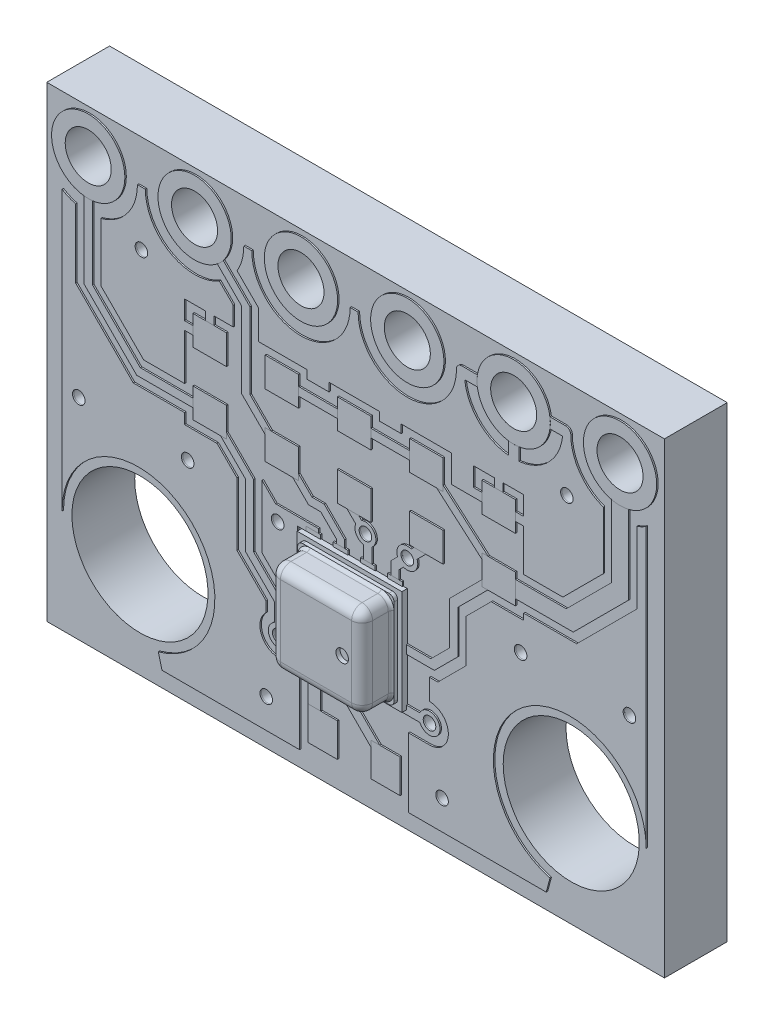
from build123d import *

# Parameters (mm, degrees)
SKETCH_1_W               = 2.5
SKETCH_1_H               = 0.13
EXTRUDE_1_DEPTH          = 1.25
EXTRUDE_2_DEPTH          = 1.25
PATTERN_CIRCULAR_1_COUNT = 2
PATTERN_CIRCULAR_1_ANGLE = 90
SKETCH_2_W               = 0.4
SKETCH_2_H               = 0.4
CUT_EXTRUDE_1_DEPTH      = 2.940360791
CUT_EXTRUDE_2_DEPTH      = 3.614842251
CUT_EXTRUDE_3_DEPTH      = 3.614842251
REVOLVE_1_ANGLE          = 90
REVOLVE_2_ANGLE          = 90
REVOLVE_3_ANGLE          = 90
REVOLVE_4_ANGLE          = 90
EXTRUDE_3_DEPTH          = 0.0884
SKETCH_10_R              = 0.15
CUT_EXTRUDE_4_DEPTH      = 0.8
SKETCH_11_R              = 0.1
EXTRUDE_4_DEPTH          = 0.015
SKETCH_11_W              = 0.35
SKETCH_11_H              = 0.35
EXTRUDE_4_2_DEPTH        = 0.015
EXTRUDE_4_3_DEPTH        = 0.015
EXTRUDE_4_4_DEPTH        = 0.015
EXTRUDE_4_5_DEPTH        = 0.015
EXTRUDE_4_6_DEPTH        = 0.015
EXTRUDE_4_7_DEPTH        = 0.015
EXTRUDE_4_8_DEPTH        = 0.015
EXTRUDE_4_9_DEPTH        = 0.015
SKETCH_14_W              = 14.75
SKETCH_14_H              = 11.15
SKETCH_14_R              = 1.625
SKETCH_14_R_2            = 0.575
SKETCH_14_R_3            = 0.15
PCB_DEPTH                = 1.5
SKETCH_15_R              = 0.575
SKETCH_15_R_2            = 0.55
EXTRUDE_6_DEPTH          = 1.5
EXTRUDE_6_2_DEPTH        = 1.5
EXTRUDE_6_3_DEPTH        = 1.5
EXTRUDE_6_4_DEPTH        = 1.5
EXTRUDE_6_5_DEPTH        = 1.5
EXTRUDE_6_6_DEPTH        = 1.5
SKETCH_16_R              = 0.875
SKETCH_16_R_2            = 0.55
EXTRUDE_7_DEPTH          = 0.035
SKETCH_17_R              = 0.875
SKETCH_17_R_2            = 0.55
EXTRUDE_8_DEPTH          = 0.035
SKETCH_18_W              = 0.8
SKETCH_18_H              = 0.7
EXTRUDE_9_DEPTH          = 0.035
EXTRUDE_9_2_DEPTH        = 0.035
EXTRUDE_9_3_DEPTH        = 0.035
EXTRUDE_9_4_DEPTH        = 0.035
EXTRUDE_9_5_DEPTH        = 0.035
EXTRUDE_9_6_DEPTH        = 0.035
EXTRUDE_9_7_DEPTH        = 0.035
EXTRUDE_9_8_DEPTH        = 0.035
EXTRUDE_9_9_DEPTH        = 0.035
EXTRUDE_9_10_DEPTH       = 0.035
SKETCH_18_W_2            = 0.7
SKETCH_18_H_2            = 0.8
EXTRUDE_9_11_DEPTH       = 0.035
EXTRUDE_9_12_DEPTH       = 0.035
SKETCH_19_R              = 0.15
EXTRUDE_11_DEPTH         = 0.035
EXTRUDE_11_2_DEPTH       = 0.035
EXTRUDE_11_3_DEPTH       = 0.035
EXTRUDE_11_4_DEPTH       = 0.035
SKETCH_20_W              = 0.35
SKETCH_20_H              = 0.5
EXTRUDE_12_DEPTH         = 0.035
EXTRUDE_12_2_DEPTH       = 0.035
EXTRUDE_12_3_DEPTH       = 0.035
EXTRUDE_12_4_DEPTH       = 0.035
EXTRUDE_12_5_DEPTH       = 0.035
EXTRUDE_12_6_DEPTH       = 0.035
EXTRUDE_12_7_DEPTH       = 0.035
EXTRUDE_12_8_DEPTH       = 0.035
SKETCH_21_R              = 0.15
EXTRUDE_13_DEPTH         = 0.035
EXTRUDE_13_2_DEPTH       = 0.035
EXTRUDE_13_3_DEPTH       = 0.035
EXTRUDE_13_4_DEPTH       = 0.035
EXTRUDE_13_5_DEPTH       = 0.035
EXTRUDE_13_6_DEPTH       = 0.035
EXTRUDE_13_7_DEPTH       = 0.035
EXTRUDE_13_8_DEPTH       = 0.035
EXTRUDE_13_9_DEPTH       = 0.035
EXTRUDE_13_10_DEPTH      = 0.035
EXTRUDE_13_11_DEPTH      = 0.035
EXTRUDE_13_12_DEPTH      = 0.035
SKETCH_21_W              = 0.925
SKETCH_21_H              = 0.2
EXTRUDE_13_13_DEPTH      = 0.035
EXTRUDE_13_14_DEPTH      = 0.035
EXTRUDE_13_15_DEPTH      = 0.035
EXTRUDE_13_16_DEPTH      = 0.035
EXTRUDE_13_17_DEPTH      = 0.035
SKETCH_21_W_2            = 0.3
SKETCH_21_H_2            = 0.95
EXTRUDE_13_18_DEPTH      = 0.035
EXTRUDE_13_19_DEPTH      = 0.035


with BuildPart() as part:
    # Эскиз1 → Бобышка-Вытянуть1 (new, symmetric)
    with BuildSketch(Plane(origin=(0, 0, 0), x_dir=(1, 0, 0), z_dir=(0, 1, 0))):
        with Locations((0, -0.065)):
            Rectangle(SKETCH_1_W, SKETCH_1_H)
    extrude(amount=EXTRUDE_1_DEPTH, both=True)


with BuildPart() as body_2:
    # Эскиз1<3> → Бобышка-Вытянуть2 (new, symmetric)
    with BuildSketch(Plane(origin=(0, 0, 0), x_dir=(1, 0, 0), z_dir=(0, 1, 0))):
        with BuildLine():
            Line((-1.103175416, -0.13), (-1.15, -0.13))
            Line((-1.15, -0.13), (-1.15, -0.21839746))
            ThreePointArc((-1.15, -0.21839746), (-1.11339746, -0.255), (-1.1, -0.305))
            Line((-1.1, -0.305), (-1.1, -0.68))
            ThreePointArc((-1.1, -0.68), (-1.026776695, -0.856776695), (-0.85, -0.93))
            Line((-0.85, -0.93), (0, -0.93))
            Line((0, -0.93), (0, -0.83))
            Line((0, -0.83), (-0.85, -0.83))
            ThreePointArc((-0.85, -0.83), (-0.956066017, -0.786066017), (-1, -0.68))
            Line((-1, -0.68), (-1, -0.305))
            ThreePointArc((-1, -0.305), (-1.027714022, -0.2034247), (-1.103175416, -0.13))
        make_face()
        with BuildLine():
            Line((1.15, -0.21839746), (1.15, -0.13))
            Line((1.15, -0.13), (1.103175416, -0.13))
            ThreePointArc((1.103175416, -0.13), (1.027714022, -0.2034247), (1, -0.305))
            Line((1, -0.305), (1, -0.68))
            ThreePointArc((1, -0.68), (0.956066017, -0.786066017), (0.85, -0.83))
            Line((0.85, -0.83), (0, -0.83))
            Line((0, -0.83), (0, -0.93))
            Line((0, -0.93), (0.85, -0.93))
            ThreePointArc((0.85, -0.93), (1.026776695, -0.856776695), (1.1, -0.68))
            Line((1.1, -0.68), (1.1, -0.305))
            ThreePointArc((1.1, -0.305), (1.11339746, -0.255), (1.15, -0.21839746))
        make_face()
    extrude(amount=EXTRUDE_2_DEPTH, both=True)


with BuildPart() as pattern_circular_1_1:
    # Круговой массив1: pattern copy
    add(body_2.part.rotate(Axis((0, 0, 0), (0, 0, 1)), 1 * PATTERN_CIRCULAR_1_ANGLE / (PATTERN_CIRCULAR_1_COUNT - 1)))


with BuildPart() as cut_extrude_1_tool:
    # Эскиз2 → Вырез-Вытянуть1 (new, through all)
    with BuildSketch(Plane.XY.offset(0.13)):
        with Locations((-1.05, 1.05)):
            Rectangle(SKETCH_2_W, SKETCH_2_H)
        with Locations((1.05, 1.05)):
            Rectangle(SKETCH_2_W, SKETCH_2_H)
        with Locations((-1.05, -1.05)):
            Rectangle(SKETCH_2_W, SKETCH_2_H)
        with Locations((1.05, -1.05)):
            Rectangle(SKETCH_2_W, SKETCH_2_H)
    extrude(amount=CUT_EXTRUDE_1_DEPTH)


with BuildPart() as body_2_1:
    add(body_2.part)

    # Вырез-Вытянуть1: cut by cut_extrude_1_tool
    add(cut_extrude_1_tool.part, mode=Mode.SUBTRACT)

    # Эскиз4 → Вырез-Вытянуть3 (cut, through all)
    with BuildSketch(Plane(origin=(0.85, 0, 0), x_dir=(0, 0, -1), z_dir=(1, 0, 0))):
        with BuildLine():
            ThreePointArc((-0.83, -1.05), (-0.903606798, -0.961803399), (-0.93, -0.85))
            Line((-0.93, -0.85), (-0.93, -1.25))
            Line((-0.93, -1.25), (-0.83, -1.25))
            Line((-0.83, -1.25), (-0.83, -1.05))
        make_face()
        with BuildLine():
            Line((-0.93, 1.25), (-0.93, 0.85))
            ThreePointArc((-0.93, 0.85), (-0.903606798, 0.961803399), (-0.83, 1.05))
            Line((-0.83, 1.05), (-0.83, 1.25))
            Line((-0.83, 1.25), (-0.93, 1.25))
        make_face()
    extrude(amount=-CUT_EXTRUDE_3_DEPTH, mode=Mode.SUBTRACT)



with BuildPart() as pattern_circular_1_1_1:
    add(pattern_circular_1_1.part)

    # Вырез-Вытянуть1: cut by cut_extrude_1_tool
    add(cut_extrude_1_tool.part, mode=Mode.SUBTRACT)

    # Эскиз3 → Вырез-Вытянуть2 (cut, through all)
    with BuildSketch(Plane.XZ.offset(0.85)):
        with BuildLine():
            ThreePointArc((-1.05, 0.83), (-0.961803399, 0.903606798), (-0.85, 0.93))
            Line((-0.85, 0.93), (-1.25, 0.93))
            Line((-1.25, 0.93), (-1.25, 0.83))
            Line((-1.25, 0.83), (-1.05, 0.83))
        make_face()
        with BuildLine():
            Line((1.25, 0.93), (0.85, 0.93))
            ThreePointArc((0.85, 0.93), (0.961803399, 0.903606798), (1.05, 0.83))
            Line((1.05, 0.83), (1.25, 0.83))
            Line((1.25, 0.83), (1.25, 0.93))
        make_face()
    extrude(amount=-CUT_EXTRUDE_2_DEPTH, mode=Mode.SUBTRACT)


with BuildPart() as body_2_2:
    add(body_2_1.part)

    add(pattern_circular_1_1_1.part)  # Повернуть1 merges Круговой массив1_1
    # Эскиз5 → Повернуть1 (revolve)
    with BuildSketch(Plane(origin=(0.85, 0, 0), x_dir=(0, 0, -1), z_dir=(1, 0, 0))):
        with BuildLine():
            Line((-0.68, 1), (-0.305, 1))
            ThreePointArc((-0.305, 1), (-0.2034247, 1.027714022), (-0.13, 1.103175416))
            Line((-0.13, 1.103175416), (-0.13, 1.15))
            Line((-0.13, 1.15), (-0.21839746, 1.15))
            ThreePointArc((-0.21839746, 1.15), (-0.255, 1.11339746), (-0.305, 1.1))
            Line((-0.305, 1.1), (-0.68, 1.1))
            ThreePointArc((-0.68, 1.1), (-0.856776695, 1.026776695), (-0.93, 0.85))
            Line((-0.93, 0.85), (-0.83, 0.85))
            ThreePointArc((-0.83, 0.85), (-0.786066017, 0.956066017), (-0.68, 1))
        make_face()
    revolve(axis=Axis((0.85, 0.85, 0.93), (0, 0, -1)), revolution_arc=REVOLVE_1_ANGLE)

    # Эскиз6 → Повернуть2 (revolve)
    with BuildSketch(Plane.XZ.offset(0.85)):
        with BuildLine():
            Line((0.85, 0.93), (0.85, 0.83))
            ThreePointArc((0.85, 0.83), (0.956066017, 0.786066017), (1, 0.68))
            Line((1, 0.68), (1, 0.305))
            ThreePointArc((1, 0.305), (1.027714022, 0.2034247), (1.103175416, 0.13))
            Line((1.103175416, 0.13), (1.15, 0.13))
            Line((1.15, 0.13), (1.15, 0.21839746))
            ThreePointArc((1.15, 0.21839746), (1.11339746, 0.255), (1.1, 0.305))
            Line((1.1, 0.305), (1.1, 0.68))
            ThreePointArc((1.1, 0.68), (1.026776695, 0.856776695), (0.85, 0.93))
        make_face()
    revolve(axis=Axis((0.85, -0.85, 0.93), (0, 0, -1)), revolution_arc=REVOLVE_2_ANGLE)

    # Эскиз7 → Повернуть3 (revolve)
    with BuildSketch(Plane.ZY.offset(0.85)):
        with BuildLine():
            Line((0.93, -0.85), (0.83, -0.85))
            ThreePointArc((0.83, -0.85), (0.786066017, -0.956066017), (0.68, -1))
            Line((0.68, -1), (0.305, -1))
            ThreePointArc((0.305, -1), (0.2034247, -1.027714022), (0.13, -1.103175416))
            Line((0.13, -1.103175416), (0.13, -1.15))
            Line((0.13, -1.15), (0.21839746, -1.15))
            ThreePointArc((0.21839746, -1.15), (0.255, -1.11339746), (0.305, -1.1))
            Line((0.305, -1.1), (0.68, -1.1))
            ThreePointArc((0.68, -1.1), (0.856776695, -1.026776695), (0.93, -0.85))
        make_face()
    revolve(axis=Axis((-0.85, -0.85, 0.93), (0, 0, -1)), revolution_arc=REVOLVE_3_ANGLE)

    # Эскиз8 → Повернуть4 (revolve)
    with BuildSketch(Plane(origin=(0, 0.85, 0), x_dir=(1, 0, 0), z_dir=(0, 1, 0))):
        with BuildLine():
            Line((-0.85, -0.93), (-0.85, -0.83))
            ThreePointArc((-0.85, -0.83), (-0.956066017, -0.786066017), (-1, -0.68))
            Line((-1, -0.68), (-1, -0.305))
            ThreePointArc((-1, -0.305), (-1.027714022, -0.2034247), (-1.103175416, -0.13))
            Line((-1.103175416, -0.13), (-1.15, -0.13))
            Line((-1.15, -0.13), (-1.15, -0.21839746))
            ThreePointArc((-1.15, -0.21839746), (-1.11339746, -0.255), (-1.1, -0.305))
            Line((-1.1, -0.305), (-1.1, -0.68))
            ThreePointArc((-1.1, -0.68), (-1.026776695, -0.856776695), (-0.85, -0.93))
        make_face()
    revolve(axis=Axis((-0.85, 0.85, 0.93), (0, 0, -1)), revolution_arc=REVOLVE_4_ANGLE)

    # Эскиз9 → Бобышка-Вытянуть3 (add)
    with BuildSketch(Plane.XY.offset(0.13)):
        with BuildLine():
            Line((-0.85, 1.15), (-1.03, 1.15))
            ThreePointArc((-1.03, 1.15), (-1.114852814, 1.114852814), (-1.15, 1.03))
            Line((-1.15, 1.03), (-1.15, 0.85))
            ThreePointArc((-1.15, 0.85), (-1.062132034, 1.062132034), (-0.85, 1.15))
        make_face()
        with BuildLine():
            Line((1.03, 1.15), (0.85, 1.15))
            ThreePointArc((0.85, 1.15), (1.062132034, 1.062132034), (1.15, 0.85))
            Line((1.15, 0.85), (1.15, 1.03))
            ThreePointArc((1.15, 1.03), (1.114852814, 1.114852814), (1.03, 1.15))
        make_face()
        with BuildLine():
            ThreePointArc((-0.85, -1.15), (-1.062132034, -1.062132034), (-1.15, -0.85))
            Line((-1.15, -0.85), (-1.15, -1.03))
            ThreePointArc((-1.15, -1.03), (-1.114852814, -1.114852814), (-1.03, -1.15))
            Line((-1.03, -1.15), (-0.85, -1.15))
        make_face()
        with BuildLine():
            Line((1.15, -1.03), (1.15, -0.85))
            ThreePointArc((1.15, -0.85), (1.062132034, -1.062132034), (0.85, -1.15))
            Line((0.85, -1.15), (1.03, -1.15))
            ThreePointArc((1.03, -1.15), (1.114852814, -1.114852814), (1.15, -1.03))
        make_face()
    extrude(amount=EXTRUDE_3_DEPTH)

    # Эскиз10 → Вырез-Вытянуть4 (cut)
    with BuildSketch(Plane.XY.offset(0.93)):
        with Locations((0.625, 0.012)):
            Circle(SKETCH_10_R)
    extrude(amount=-CUT_EXTRUDE_4_DEPTH, mode=Mode.SUBTRACT)


with BuildPart() as body_3:
    # Эскиз11 → Бобышка-Вытянуть4 (new body)
    with BuildSketch(Plane(origin=(0, 0, 0), x_dir=(-1, 0, 0), z_dir=(0, 0, -1))):
        with Locations((0.975, 0.5)):
            Circle(SKETCH_11_R)
    extrude(amount=EXTRUDE_4_DEPTH)


with BuildPart() as body_4:
    # Эскиз11 → Extrude 4 2 (new body)
    with BuildSketch(Plane(origin=(0, 0, 0), x_dir=(-1, 0, 0), z_dir=(0, 0, -1))):
        with Locations((-0.975, 0.975)):
            Rectangle(SKETCH_11_W, SKETCH_11_H)
    extrude(amount=EXTRUDE_4_2_DEPTH)


with BuildPart() as body_5:
    # Эскиз11 → Extrude 4 3 (new body)
    with BuildSketch(Plane(origin=(0, 0, 0), x_dir=(-1, 0, 0), z_dir=(0, 0, -1))):
        with Locations((-0.325, 0.975)):
            Rectangle(SKETCH_11_W, SKETCH_11_H)
    extrude(amount=EXTRUDE_4_3_DEPTH)


with BuildPart() as body_6:
    # Эскиз11 → Extrude 4 4 (new body)
    with BuildSketch(Plane(origin=(0, 0, 0), x_dir=(-1, 0, 0), z_dir=(0, 0, -1))):
        with Locations((0.325, 0.975)):
            Rectangle(SKETCH_11_W, SKETCH_11_H)
    extrude(amount=EXTRUDE_4_4_DEPTH)


with BuildPart() as body_7:
    # Эскиз11 → Extrude 4 5 (new body)
    with BuildSketch(Plane(origin=(0, 0, 0), x_dir=(-1, 0, 0), z_dir=(0, 0, -1))):
        with Locations((0.975, 0.975)):
            Rectangle(SKETCH_11_W, SKETCH_11_H)
    extrude(amount=EXTRUDE_4_5_DEPTH)


with BuildPart() as body_8:
    # Эскиз11 → Extrude 4 6 (new body)
    with BuildSketch(Plane(origin=(0, 0, 0), x_dir=(-1, 0, 0), z_dir=(0, 0, -1))):
        with Locations((-0.975, -0.975)):
            Rectangle(SKETCH_11_W, SKETCH_11_H)
    extrude(amount=EXTRUDE_4_6_DEPTH)


with BuildPart() as body_9:
    # Эскиз11 → Extrude 4 7 (new body)
    with BuildSketch(Plane(origin=(0, 0, 0), x_dir=(-1, 0, 0), z_dir=(0, 0, -1))):
        with Locations((-0.325, -0.975)):
            Rectangle(SKETCH_11_W, SKETCH_11_H)
    extrude(amount=EXTRUDE_4_7_DEPTH)


with BuildPart() as body_10:
    # Эскиз11 → Extrude 4 8 (new body)
    with BuildSketch(Plane(origin=(0, 0, 0), x_dir=(-1, 0, 0), z_dir=(0, 0, -1))):
        with Locations((0.325, -0.975)):
            Rectangle(SKETCH_11_W, SKETCH_11_H)
    extrude(amount=EXTRUDE_4_8_DEPTH)


with BuildPart() as body_11:
    # Эскиз11 → Extrude 4 9 (new body)
    with BuildSketch(Plane(origin=(0, 0, 0), x_dir=(-1, 0, 0), z_dir=(0, 0, -1))):
        with Locations((0.975, -0.975)):
            Rectangle(SKETCH_11_W, SKETCH_11_H)
    extrude(amount=EXTRUDE_4_9_DEPTH)


with BuildPart() as body_12:
    # Эскиз14 → PCB (new body)
    with BuildSketch(Plane(origin=(0, 0, -0.015), x_dir=(-1, 0, 0), z_dir=(0, 0, -1))):
        with Locations((0, 1.825)):
            Rectangle(SKETCH_14_W, SKETCH_14_H)
        with Locations((-5.15, -1.25)):
            Circle(SKETCH_14_R, mode=Mode.SUBTRACT)
        with Locations((5.15, -1.25)):
            Circle(SKETCH_14_R, mode=Mode.SUBTRACT)
        with Locations((3.81, 6.4)):
            Circle(SKETCH_14_R_2, mode=Mode.SUBTRACT)
        with Locations((-6.35, 6.4)):
            Circle(SKETCH_14_R_2, mode=Mode.SUBTRACT)
        with Locations((-3.81, 6.4)):
            Circle(SKETCH_14_R_2, mode=Mode.SUBTRACT)
        with Locations((-1.27, 6.4)):
            Circle(SKETCH_14_R_2, mode=Mode.SUBTRACT)
        with Locations((1.27, 6.4)):
            Circle(SKETCH_14_R_2, mode=Mode.SUBTRACT)
        with Locations((6.35, 6.4)):
            Circle(SKETCH_14_R_2, mode=Mode.SUBTRACT)
        with Locations((1.825, 1.1)):
            Circle(SKETCH_14_R_3, mode=Mode.SUBTRACT)
        with Locations((-5.08, 5.1)):
            Circle(SKETCH_14_R_3, mode=Mode.SUBTRACT)
        with Locations((5.08, 5.1)):
            Circle(SKETCH_14_R_3, mode=Mode.SUBTRACT)
        with Locations((-6.575, 1.3)):
            Circle(SKETCH_14_R_3, mode=Mode.SUBTRACT)
        with Locations((-3.975, 1.3)):
            Circle(SKETCH_14_R_3, mode=Mode.SUBTRACT)
        with Locations((-1.27, 1.9)):
            Circle(SKETCH_14_R_3, mode=Mode.SUBTRACT)
        with Locations((-0.27, 1.9)):
            Circle(SKETCH_14_R_3, mode=Mode.SUBTRACT)
        with Locations((6.575, 1.3)):
            Circle(SKETCH_14_R_3, mode=Mode.SUBTRACT)
        with Locations((3.975, 1.3)):
            Circle(SKETCH_14_R_3, mode=Mode.SUBTRACT)
        with Locations((1.8, -1.25)):
            Circle(SKETCH_14_R_3, mode=Mode.SUBTRACT)
        with Locations((-1.8, -1.25)):
            Circle(SKETCH_14_R_3, mode=Mode.SUBTRACT)
        with Locations((-2.1, -2.65)):
            Circle(SKETCH_14_R_3, mode=Mode.SUBTRACT)
        with Locations((2.1, -2.65)):
            Circle(SKETCH_14_R_3, mode=Mode.SUBTRACT)
    extrude(amount=PCB_DEPTH)


with BuildPart() as body_13:
    # Эскиз15 → Бобышка-Вытянуть6 (new body)
    with BuildSketch(Plane(origin=(0, 0, -1.515), x_dir=(-1, 0, 0), z_dir=(0, 0, -1))):
        with Locations((-6.35, 6.4)):
            Circle(SKETCH_15_R)
        with Locations((-6.35, 6.4)):
            Circle(SKETCH_15_R_2, mode=Mode.SUBTRACT)
    extrude(amount=-EXTRUDE_6_DEPTH)



with BuildPart() as body_14:
    # Эскиз15 → Extrude 6 2 (new body)
    with BuildSketch(Plane(origin=(0, 0, -1.515), x_dir=(-1, 0, 0), z_dir=(0, 0, -1))):
        with Locations((-3.81, 6.4)):
            Circle(SKETCH_15_R)
        with Locations((-3.81, 6.4)):
            Circle(SKETCH_15_R_2, mode=Mode.SUBTRACT)
    extrude(amount=-EXTRUDE_6_2_DEPTH)


with BuildPart() as body_15:
    # Эскиз15 → Extrude 6 3 (new body)
    with BuildSketch(Plane(origin=(0, 0, -1.515), x_dir=(-1, 0, 0), z_dir=(0, 0, -1))):
        with Locations((-1.27, 6.4)):
            Circle(SKETCH_15_R)
        with Locations((-1.27, 6.4)):
            Circle(SKETCH_15_R_2, mode=Mode.SUBTRACT)
    extrude(amount=-EXTRUDE_6_3_DEPTH)


with BuildPart() as body_16:
    # Эскиз15 → Extrude 6 4 (new body)
    with BuildSketch(Plane(origin=(0, 0, -1.515), x_dir=(-1, 0, 0), z_dir=(0, 0, -1))):
        with Locations((1.27, 6.4)):
            Circle(SKETCH_15_R)
        with Locations((1.27, 6.4)):
            Circle(SKETCH_15_R_2, mode=Mode.SUBTRACT)
    extrude(amount=-EXTRUDE_6_4_DEPTH)


with BuildPart() as body_17:
    # Эскиз15 → Extrude 6 5 (new body)
    with BuildSketch(Plane(origin=(0, 0, -1.515), x_dir=(-1, 0, 0), z_dir=(0, 0, -1))):
        with Locations((3.81, 6.4)):
            Circle(SKETCH_15_R)
        with Locations((3.81, 6.4)):
            Circle(SKETCH_15_R_2, mode=Mode.SUBTRACT)
    extrude(amount=-EXTRUDE_6_5_DEPTH)


with BuildPart() as body_18:
    # Эскиз15 → Extrude 6 6 (new body)
    with BuildSketch(Plane(origin=(0, 0, -1.515), x_dir=(-1, 0, 0), z_dir=(0, 0, -1))):
        with Locations((6.35, 6.4)):
            Circle(SKETCH_15_R)
        with Locations((6.35, 6.4)):
            Circle(SKETCH_15_R_2, mode=Mode.SUBTRACT)
    extrude(amount=-EXTRUDE_6_6_DEPTH)


with BuildPart() as body_13_1:
    add(body_13.part)

    add(body_14.part)  # Бобышка-Вытянуть7 merges body 14

    add(body_15.part)  # Бобышка-Вытянуть7 merges body 15

    add(body_16.part)  # Бобышка-Вытянуть7 merges body 16

    add(body_17.part)  # Бобышка-Вытянуть7 merges body 17

    add(body_18.part)  # Бобышка-Вытянуть7 merges body 18
    # Эскиз16 → Бобышка-Вытянуть7 (add)
    # profile 1 of 6: a face of its own
    with BuildSketch(Plane.XY.offset(-0.015)):
        with Locations((6.35, 6.4)):
            Circle(SKETCH_16_R)
        with Locations(Location((6.35, 6.4, 0), (0, 0, 180))):
            Circle(SKETCH_16_R_2, mode=Mode.SUBTRACT)
    # profile 2 of 6: a face of its own
    with BuildSketch(Plane.XY.offset(-0.015)):
        with Locations((3.81, 6.4)):
            Circle(SKETCH_16_R)
        with Locations(Location((3.81, 6.4, 0), (0, 0, 180))):
            Circle(SKETCH_16_R_2, mode=Mode.SUBTRACT)
    # profile 3 of 6: a face of its own
    with BuildSketch(Plane.XY.offset(-0.015)):
        with Locations((1.27, 6.4)):
            Circle(SKETCH_16_R)
        with Locations(Location((1.27, 6.4, 0), (0, 0, 180))):
            Circle(SKETCH_16_R_2, mode=Mode.SUBTRACT)
    # profile 4 of 6: a face of its own
    with BuildSketch(Plane.XY.offset(-0.015)):
        with Locations((-1.27, 6.4)):
            Circle(SKETCH_16_R)
        with Locations(Location((-1.27, 6.4, 0), (0, 0, 180))):
            Circle(SKETCH_16_R_2, mode=Mode.SUBTRACT)
    # profile 5 of 6: a face of its own
    with BuildSketch(Plane.XY.offset(-0.015)):
        with Locations((-3.81, 6.4)):
            Circle(SKETCH_16_R)
        with Locations(Location((-3.81, 6.4, 0), (0, 0, 180))):
            Circle(SKETCH_16_R_2, mode=Mode.SUBTRACT)
    # profile 6 of 6: a face of its own
    with BuildSketch(Plane.XY.offset(-0.015)):
        with Locations((-6.35, 6.4)):
            Circle(SKETCH_16_R)
        with Locations(Location((-6.35, 6.4, 0), (0, 0, 180))):
            Circle(SKETCH_16_R_2, mode=Mode.SUBTRACT)
    extrude(amount=EXTRUDE_7_DEPTH)

    # Эскиз17 → Бобышка-Вытянуть8 (add)
    # profile 1 of 6: a face of its own
    with BuildSketch(Plane(origin=(0, 0, -1.515), x_dir=(-1, 0, 0), z_dir=(0, 0, -1))):
        with Locations(Location((6.35, 6.4, 0), (0, 0, 180))):
            Circle(SKETCH_17_R)
        with Locations((6.35, 6.4)):
            Circle(SKETCH_17_R_2, mode=Mode.SUBTRACT)
    # profile 2 of 6: a face of its own
    with BuildSketch(Plane(origin=(0, 0, -1.515), x_dir=(-1, 0, 0), z_dir=(0, 0, -1))):
        with Locations(Location((3.81, 6.4, 0), (0, 0, 180))):
            Circle(SKETCH_17_R)
        with Locations((3.81, 6.4)):
            Circle(SKETCH_17_R_2, mode=Mode.SUBTRACT)
    # profile 3 of 6: a face of its own
    with BuildSketch(Plane(origin=(0, 0, -1.515), x_dir=(-1, 0, 0), z_dir=(0, 0, -1))):
        with Locations(Location((1.27, 6.4, 0), (0, 0, 180))):
            Circle(SKETCH_17_R)
        with Locations((1.27, 6.4)):
            Circle(SKETCH_17_R_2, mode=Mode.SUBTRACT)
    # profile 4 of 6: a face of its own
    with BuildSketch(Plane(origin=(0, 0, -1.515), x_dir=(-1, 0, 0), z_dir=(0, 0, -1))):
        with Locations(Location((-1.27, 6.4, 0), (0, 0, 180))):
            Circle(SKETCH_17_R)
        with Locations((-1.27, 6.4)):
            Circle(SKETCH_17_R_2, mode=Mode.SUBTRACT)
    # profile 5 of 6: a face of its own
    with BuildSketch(Plane(origin=(0, 0, -1.515), x_dir=(-1, 0, 0), z_dir=(0, 0, -1))):
        with Locations(Location((-3.81, 6.4, 0), (0, 0, 180))):
            Circle(SKETCH_17_R)
        with Locations((-3.81, 6.4)):
            Circle(SKETCH_17_R_2, mode=Mode.SUBTRACT)
    # profile 6 of 6: a face of its own
    with BuildSketch(Plane(origin=(0, 0, -1.515), x_dir=(-1, 0, 0), z_dir=(0, 0, -1))):
        with Locations(Location((-6.35, 6.4, 0), (0, 0, 180))):
            Circle(SKETCH_17_R)
        with Locations((-6.35, 6.4)):
            Circle(SKETCH_17_R_2, mode=Mode.SUBTRACT)
    extrude(amount=EXTRUDE_8_DEPTH)


with BuildPart() as body_14_2:
    # Эскиз18 → Бобышка-Вытянуть9 (new body)
    with BuildSketch(Plane.XY.offset(-0.015)):
        with Locations((-3.45, 4.05)):
            Rectangle(SKETCH_18_W, SKETCH_18_H)
    extrude(amount=EXTRUDE_9_DEPTH)


with BuildPart() as body_15_2:
    # Эскиз18 → Extrude 9 2 (new body)
    with BuildSketch(Plane.XY.offset(-0.015)):
        with Locations((-3.45, 2.55)):
            Rectangle(SKETCH_18_W, SKETCH_18_H)
    extrude(amount=EXTRUDE_9_2_DEPTH)


with BuildPart() as body_16_2:
    # Эскиз18 → Extrude 9 3 (new body)
    with BuildSketch(Plane.XY.offset(-0.015)):
        with Locations((-1.725, 2.55)):
            Rectangle(SKETCH_18_W, SKETCH_18_H)
    extrude(amount=EXTRUDE_9_3_DEPTH)


with BuildPart() as body_17_2:
    # Эскиз18 → Extrude 9 4 (new body)
    with BuildSketch(Plane.XY.offset(-0.015)):
        with Locations((-1.725, 4.05)):
            Rectangle(SKETCH_18_W, SKETCH_18_H)
    extrude(amount=EXTRUDE_9_4_DEPTH)


with BuildPart() as body_18_2:
    # Эскиз18 → Extrude 9 5 (new body)
    with BuildSketch(Plane.XY.offset(-0.015)):
        with Locations((0, 4.05)):
            Rectangle(SKETCH_18_W, SKETCH_18_H)
    extrude(amount=EXTRUDE_9_5_DEPTH)


with BuildPart() as body_19:
    # Эскиз18 → Extrude 9 6 (new body)
    with BuildSketch(Plane.XY.offset(-0.015)):
        with Locations((0, 2.55)):
            Rectangle(SKETCH_18_W, SKETCH_18_H)
    extrude(amount=EXTRUDE_9_6_DEPTH)


with BuildPart() as body_20:
    # Эскиз18 → Extrude 9 7 (new body)
    with BuildSketch(Plane.XY.offset(-0.015)):
        with Locations((1.725, 2.55)):
            Rectangle(SKETCH_18_W, SKETCH_18_H)
    extrude(amount=EXTRUDE_9_7_DEPTH)


with BuildPart() as body_21:
    # Эскиз18 → Extrude 9 8 (new body)
    with BuildSketch(Plane.XY.offset(-0.015)):
        with Locations((1.725, 4.05)):
            Rectangle(SKETCH_18_W, SKETCH_18_H)
    extrude(amount=EXTRUDE_9_8_DEPTH)


with BuildPart() as body_22:
    # Эскиз18 → Extrude 9 9 (new body)
    with BuildSketch(Plane.XY.offset(-0.015)):
        with Locations((3.45, 4.05)):
            Rectangle(SKETCH_18_W, SKETCH_18_H)
    extrude(amount=EXTRUDE_9_9_DEPTH)


with BuildPart() as body_23:
    # Эскиз18 → Extrude 9 10 (new body)
    with BuildSketch(Plane.XY.offset(-0.015)):
        with Locations((3.45, 2.55)):
            Rectangle(SKETCH_18_W, SKETCH_18_H)
    extrude(amount=EXTRUDE_9_10_DEPTH)


with BuildPart() as body_24:
    # Эскиз18 → Extrude 9 11 (new body)
    with BuildSketch(Plane.XY.offset(-0.015)):
        with Locations((0.75, -2.7)):
            Rectangle(SKETCH_18_W_2, SKETCH_18_H_2)
    extrude(amount=EXTRUDE_9_11_DEPTH)


with BuildPart() as body_25:
    # Эскиз18 → Extrude 9 12 (new body)
    with BuildSketch(Plane.XY.offset(-0.015)):
        with Locations((-0.75, -2.7)):
            Rectangle(SKETCH_18_W_2, SKETCH_18_H_2)
    extrude(amount=EXTRUDE_9_12_DEPTH)


with BuildPart() as body_26:
    # Эскиз19 → Бобышка-Вытянуть11 (new body)
    with BuildSketch(Plane.XY.offset(-1.515)):
        with BuildLine():
            Line((1.77, 5.336691484), (1.77, 1.9))
            ThreePointArc((1.77, 1.9), (1.27, 1.4), (0.77, 1.9))
            ThreePointArc((0.77, 1.9), (0.27, 1.4), (-0.23, 1.9))
            Line((-0.23, 1.9), (-0.23, 3.87507576))
            Line((-0.23, 3.87507576), (-1.639551273, 5.284627032))
            ThreePointArc((-1.639551273, 5.284627032), (-2.222587987, 5.71210384), (-2.445, 6.4))
            Line((-2.445, 6.4), (-2.635, 6.4))
            ThreePointArc((-2.635, 6.4), (-3.81, 5.225), (-4.985, 6.4))
            Line((-4.985, 6.4), (-5.175, 6.4))
            ThreePointArc((-5.175, 6.4), (-5.835825905, 5.34347267), (-7.075, 5.4753379))
            Line((-7.075, 5.4753379), (-7.075, -1.25))
            ThreePointArc((-7.075, -1.25), (-3.978134249, 0.27720518), (-4.651773338, -3.109407216))
            Line((-4.651773338, -3.109407216), (-4.560511777, -3.45))
            Line((-4.560511777, -3.45), (4.560511777, -3.45))
            Line((4.560511777, -3.45), (4.651773338, -3.109407216))
            ThreePointArc((4.651773338, -3.109407216), (3.978134249, 0.27720518), (7.075, -1.25))
            Line((7.075, -1.25), (7.075, 5.4753379))
            ThreePointArc((7.075, 5.4753379), (5.835825905, 5.34347267), (5.175, 6.4))
            ThreePointArc((5.175, 6.4), (5.138388348, 6.488388348), (5.05, 6.525))
            Line((5.05, 6.525), (4.676025404, 6.525))
            ThreePointArc((4.676025404, 6.525), (4.685, 6.4), (4.676025404, 6.275))
            Line((4.676025404, 6.275), (4.978332145, 6.275))
            ThreePointArc((4.978332145, 6.275), (4.640850468, 5.569149532), (3.935, 5.231667855))
            Line((3.935, 5.231667855), (3.935, 5.533974596))
            ThreePointArc((3.935, 5.533974596), (3.81, 5.525), (3.685, 5.533974596))
            Line((3.685, 5.533974596), (3.685, 5.231667855))
            ThreePointArc((3.685, 5.231667855), (2.979149532, 5.569149532), (2.641667855, 6.275))
            Line((2.641667855, 6.275), (2.943974596, 6.275))
            ThreePointArc((2.943974596, 6.275), (2.935, 6.4), (2.943974596, 6.525))
            Line((2.943974596, 6.525), (2.57, 6.525))
            ThreePointArc((2.57, 6.525), (2.481611652, 6.488388348), (2.445, 6.4))
            ThreePointArc((2.445, 6.4), (2.261999244, 5.770267914), (1.77, 5.336691484))
        make_face()
        with Locations(Location((-2.1, -2.65, 0), (0, 0, 180))):
            Circle(SKETCH_19_R, mode=Mode.SUBTRACT)
        with Locations(Location((-6.575, 1.3, 0), (0, 0, 180))):
            Circle(SKETCH_19_R, mode=Mode.SUBTRACT)
        with Locations(Location((-3.975, 1.3, 0), (0, 0, 180))):
            Circle(SKETCH_19_R, mode=Mode.SUBTRACT)
        with Locations(Location((-1.825, 1.1, 0), (0, 0, 180))):
            Circle(SKETCH_19_R, mode=Mode.SUBTRACT)
        with Locations(Location((2.1, -2.65, 0), (0, 0, 180))):
            Circle(SKETCH_19_R, mode=Mode.SUBTRACT)
        with BuildLine():
            ThreePointArc((-1.570871215, -1.75), (-2.35, -1.25), (-1.570871215, -0.75))
            Line((-1.570871215, -0.75), (1.570871215, -0.75))
            ThreePointArc((1.570871215, -0.75), (2.35, -1.25), (1.570871215, -1.75))
            Line((1.570871215, -1.75), (-1.570871215, -1.75))
        make_face(mode=Mode.SUBTRACT)
        with Locations(Location((3.975, 1.3, 0), (0, 0, 180))):
            Circle(SKETCH_19_R, mode=Mode.SUBTRACT)
        with Locations(Location((6.575, 1.3, 0), (0, 0, 180))):
            Circle(SKETCH_19_R, mode=Mode.SUBTRACT)
        with Locations(Location((-5.08, 5.1, 0), (0, 0, 180))):
            Circle(SKETCH_19_R, mode=Mode.SUBTRACT)
        with Locations(Location((5.08, 5.1, 0), (0, 0, 180))):
            Circle(SKETCH_19_R, mode=Mode.SUBTRACT)
    extrude(amount=-EXTRUDE_11_DEPTH)


with BuildPart() as body_27:
    # Эскиз19 → Extrude 11 2 (new body)
    with BuildSketch(Plane.XY.offset(-1.515)):
        with BuildLine():
            Line((1.47, 2.05), (1.47, 5.548163748))
            ThreePointArc((1.47, 5.548163748), (1.27, 5.525), (1.07, 5.548163748))
            Line((1.07, 5.548163748), (1.07, 2.05))
            ThreePointArc((1.07, 2.05), (1.27, 1.65), (1.47, 2.05))
        make_face()
        with Locations(Location((1.27, 1.9, 0), (0, 0, 180))):
            Circle(SKETCH_19_R, mode=Mode.SUBTRACT)
    extrude(amount=-EXTRUDE_11_2_DEPTH)


with BuildPart() as body_28:
    # Эскиз19 → Extrude 11 3 (new body)
    with BuildSketch(Plane.XY.offset(-1.515)):
        with BuildLine():
            Line((0.07, 3.999339828), (0.07, 2.05))
            ThreePointArc((0.07, 2.05), (0.27, 1.65), (0.47, 2.05))
            Line((0.47, 2.05), (0.47, 4.165025253))
            Line((0.47, 4.165025253), (-0.950422562, 5.585447815))
            ThreePointArc((-0.950422562, 5.585447815), (-1.213347234, 5.526835947), (-1.481641366, 5.550981195))
            Line((-1.481641366, 5.550981195), (0.07, 3.999339828))
        make_face()
        with Locations(Location((0.27, 1.9, 0), (0, 0, 180))):
            Circle(SKETCH_19_R, mode=Mode.SUBTRACT)
    extrude(amount=-EXTRUDE_11_3_DEPTH)


with BuildPart() as body_29:
    # Эскиз19 → Extrude 11 4 (new body)
    with BuildSketch(Plane.XY.offset(-1.515)):
        with BuildLine():
            ThreePointArc((-1.65, -1.05), (-2.05, -1.25), (-1.65, -1.45))
            Line((-1.65, -1.45), (1.65, -1.45))
            ThreePointArc((1.65, -1.45), (2.05, -1.25), (1.65, -1.05))
            Line((1.65, -1.05), (-1.65, -1.05))
        make_face()
        with Locations(Location((-1.8, -1.25, 0), (0, 0, 180))):
            Circle(SKETCH_19_R, mode=Mode.SUBTRACT)
        with Locations(Location((1.8, -1.25, 0), (0, 0, 180))):
            Circle(SKETCH_19_R, mode=Mode.SUBTRACT)
    extrude(amount=-EXTRUDE_11_4_DEPTH)


with BuildPart() as body_30:
    # Эскиз20 → Бобышка-Вытянуть12 (new body)
    with BuildSketch(Plane.XY.offset(-0.015)):
        with Locations((0.975, -1.1)):
            Rectangle(SKETCH_20_W, SKETCH_20_H)
    extrude(amount=EXTRUDE_12_DEPTH)


with BuildPart() as body_31:
    # Эскиз20 → Extrude 12 2 (new body)
    with BuildSketch(Plane.XY.offset(-0.015)):
        with Locations((0.325, -1.1)):
            Rectangle(SKETCH_20_W, SKETCH_20_H)
    extrude(amount=EXTRUDE_12_2_DEPTH)


with BuildPart() as body_32:
    # Эскиз20 → Extrude 12 3 (new body)
    with BuildSketch(Plane.XY.offset(-0.015)):
        with Locations((-0.325, -1.1)):
            Rectangle(SKETCH_20_W, SKETCH_20_H)
    extrude(amount=EXTRUDE_12_3_DEPTH)


with BuildPart() as body_33:
    # Эскиз20 → Extrude 12 4 (new body)
    with BuildSketch(Plane.XY.offset(-0.015)):
        with Locations((-0.975, -1.1)):
            Rectangle(SKETCH_20_W, SKETCH_20_H)
    extrude(amount=EXTRUDE_12_4_DEPTH)


with BuildPart() as body_34:
    # Эскиз20 → Extrude 12 5 (new body)
    with BuildSketch(Plane.XY.offset(-0.015)):
        with Locations((-0.975, 1.1)):
            Rectangle(SKETCH_20_W, SKETCH_20_H)
    extrude(amount=EXTRUDE_12_5_DEPTH)


with BuildPart() as body_35:
    # Эскиз20 → Extrude 12 6 (new body)
    with BuildSketch(Plane.XY.offset(-0.015)):
        with Locations((-0.325, 1.1)):
            Rectangle(SKETCH_20_W, SKETCH_20_H)
    extrude(amount=EXTRUDE_12_6_DEPTH)


with BuildPart() as body_36:
    # Эскиз20 → Extrude 12 7 (new body)
    with BuildSketch(Plane.XY.offset(-0.015)):
        with Locations((0.325, 1.1)):
            Rectangle(SKETCH_20_W, SKETCH_20_H)
    extrude(amount=EXTRUDE_12_7_DEPTH)


with BuildPart() as body_37:
    # Эскиз20 → Extrude 12 8 (new body)
    with BuildSketch(Plane.XY.offset(-0.015)):
        with Locations((0.975, 1.1)):
            Rectangle(SKETCH_20_W, SKETCH_20_H)
    extrude(amount=EXTRUDE_12_8_DEPTH)


with BuildPart() as body_38:
    # Эскиз21 → Бобышка-Вытянуть13 (new body)
    with BuildSketch(Plane.XY.offset(-0.015)):
        with BuildLine():
            Line((1.3, -1.7), (1.3, -3.35))
            Line((1.3, -3.35), (4.587306696, -3.35))
            Line((4.587306696, -3.35), (4.677655243, -3.012814633))
            ThreePointArc((4.677655243, -3.012814633), (4.039010392, 0.197869846), (6.975, -1.25))
            Line((6.975, -1.25), (6.975, 5.405012563))
            ThreePointArc((6.975, 5.405012563), (6.865433791, 5.344086648), (6.75, 5.29518101))
            Line((6.75, 5.29518101), (6.75, 3.584314575))
            Line((6.75, 3.584314575), (5.315685425, 2.15))
            Line((5.315685425, 2.15), (4.05, 2.15))
            Line((4.05, 2.15), (4.05, 2))
            Line((4.05, 2), (3.274264069, 2))
            Line((3.274264069, 2), (2.675, 1.400735931))
            Line((2.675, 1.400735931), (2.675, 0.375735931))
            Line((2.675, 0.375735931), (1.999264069, -0.3))
            Line((1.999264069, -0.3), (1.8, -0.3))
            Line((1.8, -0.3), (1.8, -0.8))
            ThreePointArc((1.8, -0.8), (2.25, -1.25), (1.8, -1.7))
            Line((1.8, -1.7), (1.3, -1.7))
        make_face()
        with Locations((2.1, -2.65)):
            Circle(SKETCH_21_R, mode=Mode.SUBTRACT)
        with Locations((3.975, 1.3)):
            Circle(SKETCH_21_R, mode=Mode.SUBTRACT)
        with Locations((6.575, 1.3)):
            Circle(SKETCH_21_R, mode=Mode.SUBTRACT)
    extrude(amount=EXTRUDE_13_DEPTH)


with BuildPart() as body_39:
    # Эскиз21 → Extrude 13 2 (new body)
    with BuildSketch(Plane.XY.offset(-0.015)):
        with BuildLine():
            Line((-4.587306696, -3.35), (-1.3, -3.35))
            Line((-1.3, -3.35), (-1.3, -1.7))
            Line((-1.3, -1.7), (-1.8, -1.7))
            ThreePointArc((-1.8, -1.7), (-2.220377562, -1.41056994), (-2.1, -0.914589803))
            Line((-2.1, -0.914589803), (-2.1, -0.674264069))
            Line((-2.1, -0.674264069), (-2.8, 0.025735931))
            Line((-2.8, 0.025735931), (-2.8, 1.525735931))
            Line((-2.8, 1.525735931), (-3.274264069, 2))
            Line((-3.274264069, 2), (-4.05, 2))
            Line((-4.05, 2), (-4.05, 2.25))
            Line((-4.05, 2.25), (-5.274264069, 2.25))
            Line((-5.274264069, 2.25), (-6.65, 3.625735931))
            Line((-6.65, 3.625735931), (-6.65, 5.263943223))
            ThreePointArc((-6.65, 5.263943223), (-6.817847614, 5.322157892), (-6.975, 5.405012563))
            Line((-6.975, 5.405012563), (-6.975, -1.250000007))
            ThreePointArc((-6.975, -1.250000007), (-4.039010395, 0.197869848), (-4.677655243, -3.012814633))
            Line((-4.677655243, -3.012814633), (-4.587306696, -3.35))
        make_face()
        with Locations((-2.1, -2.65)):
            Circle(SKETCH_21_R, mode=Mode.SUBTRACT)
        with Locations((-6.575, 1.3)):
            Circle(SKETCH_21_R, mode=Mode.SUBTRACT)
        with Locations((-3.975, 1.3)):
            Circle(SKETCH_21_R, mode=Mode.SUBTRACT)
    extrude(amount=EXTRUDE_13_2_DEPTH)


with BuildPart() as body_40:
    # Эскиз21 → Extrude 13 3 (new body)
    with BuildSketch(Plane.XY.offset(-0.015)):
        with BuildLine():
            Line((1.15, -1.15), (1.15, -1.35))
            Line((1.15, -1.35), (1.570871215, -1.35))
            ThreePointArc((1.570871215, -1.35), (2.05, -1.25), (1.570871215, -1.15))
            Line((1.570871215, -1.15), (1.15, -1.15))
        make_face()
        with Locations((1.8, -1.25)):
            Circle(SKETCH_21_R, mode=Mode.SUBTRACT)
    extrude(amount=EXTRUDE_13_3_DEPTH)


with BuildPart() as body_41:
    # Эскиз21 → Extrude 13 4 (new body)
    with BuildSketch(Plane.XY.offset(-0.015)):
        with BuildLine():
            Line((-1.7, -0.508578644), (-2.4, 0.191421356))
            Line((-2.4, 0.191421356), (-2.4, 1.691421356))
            Line((-2.4, 1.691421356), (-3.05, 2.341421356))
            Line((-3.05, 2.341421356), (-3.05, 2.2))
            Line((-3.05, 2.2), (-3.191421356, 2.2))
            Line((-3.191421356, 2.2), (-2.6, 1.608578644))
            Line((-2.6, 1.608578644), (-2.6, 0.108578644))
            Line((-2.6, 0.108578644), (-1.9, -0.591421356))
            Line((-1.9, -0.591421356), (-1.9, -1.020871215))
            ThreePointArc((-1.9, -1.020871215), (-1.8, -1.5), (-1.7, -1.020871215))
            Line((-1.7, -1.020871215), (-1.7, -0.508578644))
        make_face()
        with Locations((-1.8, -1.25)):
            Circle(SKETCH_21_R, mode=Mode.SUBTRACT)
    extrude(amount=EXTRUDE_13_4_DEPTH)


with BuildPart() as body_42:
    # Эскиз21 → Extrude 13 5 (new body)
    with BuildSketch(Plane.XY.offset(-0.015)):
        Polygon((-2.2, 0.274264069), (-1.5, -0.425735931), (-1.35, -0.425735931), (-1.35, 1.25), (-1.15, 1.25), (-1.15, 1.35), (-0.85, 1.35), (-0.85, 1.45), (-1.875735931, 1.45), (-2.2, 1.774264069), align=None)
        with Locations((-1.825, 1.1)):
            Circle(SKETCH_21_R, mode=Mode.SUBTRACT)
    extrude(amount=EXTRUDE_13_5_DEPTH)


with BuildPart() as body_43:
    # Эскиз21 → Extrude 13 6 (new body)
    with BuildSketch(Plane.XY.offset(-0.015)):
        with BuildLine():
            Line((5.232842712, 2.35), (6.55, 3.667157288))
            Line((6.55, 3.667157288), (6.55, 5.548163748))
            ThreePointArc((6.55, 5.548163748), (6.35, 5.525), (6.15, 5.548163748))
            Line((6.15, 5.548163748), (6.15, 3.832842712))
            Line((6.15, 3.832842712), (5.067157288, 2.75))
            Line((5.067157288, 2.75), (3.85, 2.75))
            Line((3.85, 2.75), (3.85, 2.35))
            Line((3.85, 2.35), (5.232842712, 2.35))
        make_face()
    extrude(amount=EXTRUDE_13_6_DEPTH)


with BuildPart() as body_44:
    # Эскиз21 → Extrude 13 7 (new body)
    with BuildSketch(Plane.XY.offset(-0.015)):
        with BuildLine():
            Line((-4.985, 6.4), (-5.175, 6.4))
            ThreePointArc((-5.175, 6.4), (-5.419106612, 5.68301848), (-6.05, 5.263943223))
            Line((-6.05, 5.263943223), (-6.05, 3.874264069))
            Line((-6.05, 3.874264069), (-5.025735931, 2.85))
            Line((-5.025735931, 2.85), (-4.05, 2.85))
            Line((-4.05, 2.85), (-4.05, 3.95))
            Line((-4.05, 3.95), (-3.85, 3.95))
            Line((-3.85, 3.95), (-3.85, 4.15))
            Line((-3.85, 4.15), (-4.05, 4.15))
            Line((-4.05, 4.15), (-4.05, 4.6))
            Line((-4.05, 4.6), (-3.55, 4.6))
            Line((-3.55, 4.6), (-3.55, 4.4))
            Line((-3.55, 4.4), (-3.35, 4.4))
            Line((-3.35, 4.4), (-3.35, 4.6))
            Line((-3.35, 4.6), (-2.8875, 4.6))
            Line((-2.8875, 4.6), (-2.8875, 5.053235931))
            Line((-2.8875, 5.053235931), (-3.218818584, 5.384554515))
            ThreePointArc((-3.218818584, 5.384554515), (-4.395656399, 5.381357972), (-4.985, 6.4))
        make_face()
        with Locations((-5.08, 5.1)):
            Circle(SKETCH_21_R, mode=Mode.SUBTRACT)
    extrude(amount=EXTRUDE_13_7_DEPTH)


with BuildPart() as body_45:
    # Эскиз21 → Extrude 13 8 (new body)
    with BuildSketch(Plane.XY.offset(-0.015)):
        with BuildLine():
            Line((-6.25, 3.791421356), (-6.25, 5.530733067))
            ThreePointArc((-6.25, 5.530733067), (-6.35, 5.525), (-6.45, 5.530733067))
            Line((-6.45, 5.530733067), (-6.45, 3.708578644))
            Line((-6.45, 3.708578644), (-5.191421356, 2.45))
            Line((-5.191421356, 2.45), (-3.85, 2.45))
            Line((-3.85, 2.45), (-3.85, 2.65))
            Line((-3.85, 2.65), (-5.108578644, 2.65))
            Line((-5.108578644, 2.65), (-6.25, 3.791421356))
        make_face()
    extrude(amount=EXTRUDE_13_8_DEPTH)


with BuildPart() as body_46:
    # Эскиз21 → Extrude 13 9 (new body)
    with BuildSketch(Plane.XY.offset(-0.015)):
        with BuildLine():
            ThreePointArc((5.95, 5.29518101), (5.38806835, 5.725231521), (5.175, 6.4))
            ThreePointArc((5.175, 6.4), (5.138388348, 6.488388348), (5.05, 6.525))
            Line((5.05, 6.525), (4.676025404, 6.525))
            ThreePointArc((4.676025404, 6.525), (4.685, 6.4), (4.676025404, 6.275))
            Line((4.676025404, 6.275), (4.978332145, 6.275))
            ThreePointArc((4.978332145, 6.275), (4.640850468, 5.569149532), (3.935, 5.231667855))
            Line((3.935, 5.231667855), (3.935, 5.533974596))
            ThreePointArc((3.935, 5.533974596), (3.81, 5.525), (3.685, 5.533974596))
            Line((3.685, 5.533974596), (3.685, 5.231667855))
            ThreePointArc((3.685, 5.231667855), (2.979149532, 5.569149532), (2.641667855, 6.275))
            Line((2.641667855, 6.275), (2.943974596, 6.275))
            ThreePointArc((2.943974596, 6.275), (2.935, 6.4), (2.943974596, 6.525))
            Line((2.943974596, 6.525), (2.57, 6.525))
            ThreePointArc((2.57, 6.525), (2.481611652, 6.488388348), (2.445, 6.4))
            ThreePointArc((2.445, 6.4), (1.27, 5.225), (0.095, 6.4))
            Line((0.095, 6.4), (-0.095, 6.4))
            ThreePointArc((-0.095, 6.4), (-1.27, 5.225), (-2.445, 6.4))
            Line((-2.445, 6.4), (-2.635, 6.4))
            ThreePointArc((-2.635, 6.4), (-2.675589703, 6.093832925), (-2.794554515, 5.808818584))
            Line((-2.794554515, 5.808818584), (-2.2875, 5.301764069))
            Line((-2.2875, 5.301764069), (-2.2875, 4.6))
            Line((-2.2875, 4.6), (-1.125, 4.6))
            Line((-1.125, 4.6), (-1.125, 4.4))
            Line((-1.125, 4.4), (-0.6, 4.4))
            Line((-0.6, 4.4), (-0.6, 4.6))
            Line((-0.6, 4.6), (0.6, 4.6))
            Line((0.6, 4.6), (0.6, 4.4))
            Line((0.6, 4.4), (1.125, 4.4))
            Line((1.125, 4.4), (1.125, 4.6))
            Line((1.125, 4.6), (2.325, 4.6))
            Line((2.325, 4.6), (2.325, 3.95))
            Line((2.325, 3.95), (3.05, 3.95))
            Line((3.05, 3.95), (3.05, 4.15))
            Line((3.05, 4.15), (2.85, 4.15))
            Line((2.85, 4.15), (2.85, 4.6))
            Line((2.85, 4.6), (3.35, 4.6))
            Line((3.35, 4.6), (3.35, 4.4))
            Line((3.35, 4.4), (3.55, 4.4))
            Line((3.55, 4.4), (3.55, 4.6))
            Line((3.55, 4.6), (4.05, 4.6))
            Line((4.05, 4.6), (4.05, 4.15))
            Line((4.05, 4.15), (3.85, 4.15))
            Line((3.85, 4.15), (3.85, 3.95))
            Line((3.85, 3.95), (4.05, 3.95))
            Line((4.05, 3.95), (4.05, 2.95))
            Line((4.05, 2.95), (4.984314575, 2.95))
            Line((4.984314575, 2.95), (5.95, 3.915685425))
            Line((5.95, 3.915685425), (5.95, 5.29518101))
        make_face()
        with Locations((5.08, 5.1)):
            Circle(SKETCH_21_R, mode=Mode.SUBTRACT)
    extrude(amount=EXTRUDE_13_9_DEPTH)


with BuildPart() as body_47:
    # Эскиз21 → Extrude 13 10 (new body)
    with BuildSketch(Plane.XY.offset(-0.015)):
        Polygon((3.05, 2.341421356), (2.275, 1.566421356), (2.275, 0.541421356), (1.833578644, 0.1), (0, 0.1), (0, -0.1), (1.916421356, -0.1), (2.475, 0.458578644), (2.475, 1.483578644), (3.191421356, 2.2), (3.05, 2.2), align=None)
    extrude(amount=EXTRUDE_13_10_DEPTH)


with BuildPart() as body_48:
    # Эскиз21 → Extrude 13 11 (new body)
    with BuildSketch(Plane.XY.offset(-0.015)):
        with BuildLine():
            ThreePointArc((-3.124624779, 5.856046135), (-3.191281566, 5.781281566), (-3.266046135, 5.714624779))
            Line((-3.266046135, 5.714624779), (-2.6875, 5.136078644))
            Line((-2.6875, 5.136078644), (-2.6875, 3.321078644))
            Line((-2.6875, 3.321078644), (-2.125, 2.758578644))
            Line((-2.125, 2.758578644), (-2.125, 2.9))
            Line((-2.125, 2.9), (-1.983578644, 2.9))
            Line((-1.983578644, 2.9), (-2.4875, 3.403921356))
            Line((-2.4875, 3.403921356), (-2.4875, 5.218921356))
            Line((-2.4875, 5.218921356), (-3.124624779, 5.856046135))
        make_face()
    extrude(amount=EXTRUDE_13_11_DEPTH)


with BuildPart() as body_49:
    # Эскиз21 → Extrude 13 12 (new body)
    with BuildSketch(Plane.XY.offset(-0.015)):
        Polygon((3.202869685, 2.9), (2.125, 3.83221162), (2.125, 3.7), (1.972130315, 3.7), (3.05, 2.76778838), (3.05, 2.9), align=None)
    extrude(amount=EXTRUDE_13_12_DEPTH)


with BuildPart() as body_50:
    # Эскиз21 → Extrude 13 13 (new body)
    with BuildSketch(Plane.XY.offset(-0.015)):
        with Locations((-0.8625, 4.05)):
            Rectangle(SKETCH_21_W, SKETCH_21_H)
    extrude(amount=EXTRUDE_13_13_DEPTH)


with BuildPart() as body_51:
    # Эскиз21 → Extrude 13 14 (new body)
    with BuildSketch(Plane.XY.offset(-0.015)):
        Polygon((-1.325, 2.2), (-1.466421356, 2.2), (-1.088649749, 1.822228393), (-0.797228393, 1.822228393), (-0.425, 1.45), (-0.425, 1.35), (-0.225, 1.35), (-0.225, 1.532842712), (-0.71438568, 2.022228393), (-1.005807036, 2.022228393), (-1.325, 2.341421356), align=None)
    extrude(amount=EXTRUDE_13_14_DEPTH)


with BuildPart() as body_52:
    # Эскиз21 → Extrude 13 15 (new body)
    with BuildSketch(Plane.XY.offset(-0.015)):
        with Locations((0.8625, 4.05)):
            Rectangle(SKETCH_21_W, SKETCH_21_H)
    extrude(amount=EXTRUDE_13_15_DEPTH)


with BuildPart() as body_53:
    # Эскиз21 → Extrude 13 16 (new body)
    with BuildSketch(Plane.XY.offset(-0.015)):
        with BuildLine():
            Line((1.711421356, 2.2), (1.428578644, 2.2))
            Line((1.428578644, 2.2), (1.361307839, 2.132729196))
            ThreePointArc((1.361307839, 2.132729196), (1.093223305, 2.076776695), (1.037270804, 1.808692161))
            Line((1.037270804, 1.808692161), (0.875, 1.646421356))
            Line((0.875, 1.646421356), (0.875, 1.35))
            Line((0.875, 1.35), (1.075, 1.35))
            Line((1.075, 1.35), (1.075, 1.563578644))
            Line((1.075, 1.563578644), (1.178692161, 1.667270804))
            ThreePointArc((1.178692161, 1.667270804), (1.446776695, 1.723223305), (1.502729196, 1.991307839))
            Line((1.502729196, 1.991307839), (1.711421356, 2.2))
        make_face()
        with Locations((1.27, 1.9)):
            Circle(SKETCH_21_R, mode=Mode.SUBTRACT)
    extrude(amount=EXTRUDE_13_16_DEPTH)


with BuildPart() as body_54:
    # Эскиз21 → Extrude 13 17 (new body)
    with BuildSketch(Plane.XY.offset(-0.015)):
        with BuildLine():
            Line((0.178692161, 2.132729196), (0.111421356, 2.2))
            Line((0.111421356, 2.2), (-0.171421356, 2.2))
            Line((-0.171421356, 2.2), (0.037270804, 1.991307839))
            ThreePointArc((0.037270804, 1.991307839), (0.051565877, 1.778400107), (0.225, 1.654083347))
            Line((0.225, 1.654083347), (0.225, 1.35))
            Line((0.225, 1.35), (0.425, 1.35))
            Line((0.425, 1.35), (0.425, 1.703849548))
            ThreePointArc((0.425, 1.703849548), (0.48679163, 2.024504574), (0.178692161, 2.132729196))
        make_face()
        with Locations((0.27, 1.9)):
            Circle(SKETCH_21_R, mode=Mode.SUBTRACT)
    extrude(amount=EXTRUDE_13_17_DEPTH)


with BuildPart() as body_55:
    # Эскиз21 → Extrude 13 18 (new body)
    with BuildSketch(Plane.XY.offset(-0.015)):
        with Locations((-0.95, -1.825)):
            Rectangle(SKETCH_21_W_2, SKETCH_21_H_2)
    extrude(amount=EXTRUDE_13_18_DEPTH)


with BuildPart() as body_56:
    # Эскиз21 → Extrude 13 19 (new body)
    with BuildSketch(Plane.XY.offset(-0.015)):
        Polygon((-0.175, -1.35), (-0.425, -1.35), (-0.425, -1.616421356), (0.4, -2.441421356), (0.4, -2.3), (0.612132034, -2.3), (-0.175, -1.512867966), align=None)
    extrude(amount=EXTRUDE_13_19_DEPTH)


solid = Compound([part.part, body_2_2.part, body_3.part, body_4.part, body_5.part, body_6.part, body_7.part, body_8.part, body_9.part, body_10.part, body_11.part, body_12.part, body_13_1.part, body_14_2.part, body_15_2.part, body_16_2.part, body_17_2.part, body_18_2.part, body_19.part, body_20.part, body_21.part, body_22.part, body_23.part, body_24.part, body_25.part, body_26.part, body_27.part, body_28.part, body_29.part, body_30.part, body_31.part, body_32.part, body_33.part, body_34.part, body_35.part, body_36.part, body_37.part, body_38.part, body_39.part, body_40.part, body_41.part, body_42.part, body_43.part, body_44.part, body_45.part, body_46.part, body_47.part, body_48.part, body_49.part, body_50.part, body_51.part, body_52.part, body_53.part, body_54.part, body_55.part, body_56.part])
